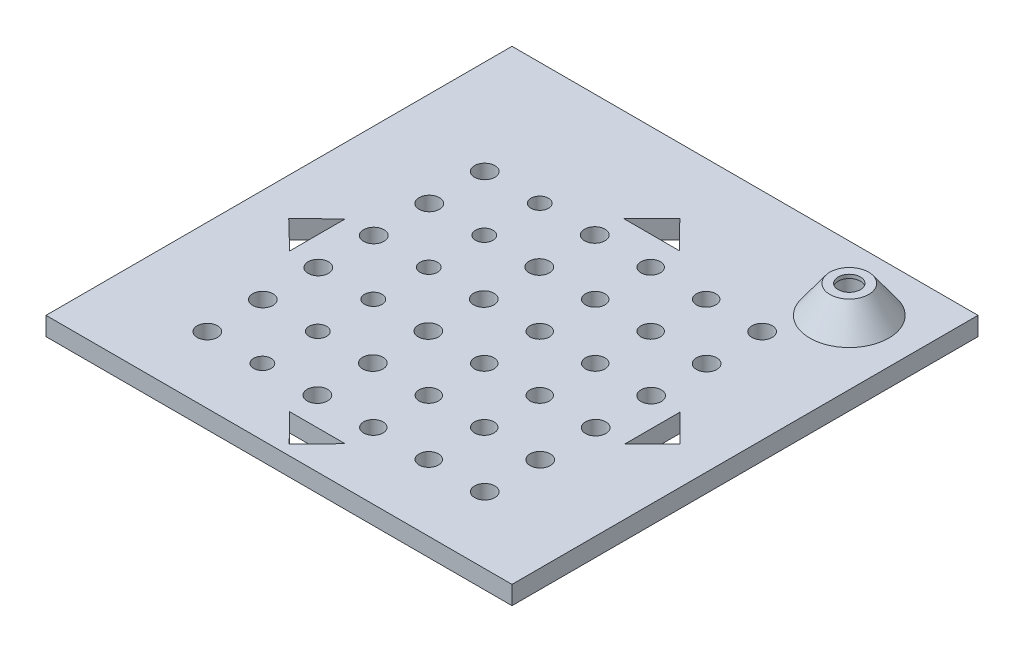
from build123d import *

# Parameters (mm, degrees)
SKETCH1_W           = 126
SKETCH1_H           = 126
BOSS_EXTRUDE1_DEPTH = 5
SKETCH3_R           = 12.5
BOSS_EXTRUDE2_DEPTH = 7.5
SKETCH4_R           = 3.45
CUT_EXTRUDE1_DEPTH  = 11.5
SKETCH6_R           = 3
CUT_EXTRUDE2_DEPTH  = 179.628805068
CHAMFER1_SIZE       = 10
CHAMFER1_SIZE_2     = 7.26542528
SKETCH7_R           = 2.75
SKETCH7_R_2         = 2.625
SKETCH7_R_3         = 2.375
CUT_EXTRUDE3_DEPTH  = 179.348675353
CUT_EXTRUDE4_DEPTH  = 179.348675353


with BuildPart() as part:
    # Sketch1 → Boss-Extrude1 (new body)
    with BuildSketch(Plane(origin=(0, 0, 0), x_dir=(1, 0, 0), z_dir=(0, 1, 0))):
        with Locations((63, 63)):
            Rectangle(SKETCH1_W, SKETCH1_H)
    extrude(amount=BOSS_EXTRUDE1_DEPTH)

    # Sketch3 → Boss-Extrude2 (add)
    with BuildSketch(Plane(origin=(0, 5, 0), x_dir=(1, 0, 0), z_dir=(0, 1, 0))):
        with Locations(Location((108.6, 108.6, 0), (0, 0, 90))):
            Circle(SKETCH3_R)
    extrude(amount=BOSS_EXTRUDE2_DEPTH)

    # Sketch4 → Cut-Extrude1 (cut)
    with BuildSketch(Plane.XZ):
        with Locations(Location((108.6, -108.6, 0), (0, 0, 270))):
            Circle(SKETCH4_R)
    extrude(amount=-CUT_EXTRUDE1_DEPTH, mode=Mode.SUBTRACT)

    # Sketch6 → Cut-Extrude2 (cut, through all)
    with BuildSketch(Plane(origin=(0, 12.5, 0), x_dir=(1, 0, 0), z_dir=(0, 1, 0))):
        with Locations(Location((108.6, 108.6, 0), (0, 0, 270))):
            Circle(SKETCH6_R)
    extrude(amount=-CUT_EXTRUDE2_DEPTH, mode=Mode.SUBTRACT)

    # Chamfer1
    # the kernel refuses this chamfer: 10, 7.26542528 mm, written as the material it takes off along each edge
    with BuildSketch(Plane(origin=(108.6, 12.5, -108.6), x_dir=(0, 0, -1), z_dir=(1, 0, 0))) as chamfer1_piece_1_section:
        Polygon((12.5, -CHAMFER1_SIZE), (12.5 - CHAMFER1_SIZE_2, 0), (12.5, 0), align=None)
    chamfer1_piece_1 = revolve(axis=Axis((108.6, 12.5, -108.6), (0, 1, 0)), mode=Mode.PRIVATE)
    chamfer1_piece_1 = split(chamfer1_piece_1, bisect_by=Plane(origin=(108.6, 5, -100.650989912), z_dir=(0, 1, 0)), keep=Keep.TOP, mode=Mode.PRIVATE)
    add(chamfer1_piece_1, mode=Mode.SUBTRACT)

    # Sketch7 → Cut-Extrude3 (cut, through all)
    with BuildSketch(Plane(origin=(0, 5, 0), x_dir=(1, 0, 0), z_dir=(0, 1, 0))):
        with Locations(Location((55.375, 63, 0), (0, 0, 270))):
            Circle(SKETCH7_R)
        with Locations(Location((70.5, 63, 0), (0, 0, 270))):
            Circle(SKETCH7_R_2)
        with Locations(Location((40.5, 63, 0), (0, 0, 270))):
            Circle(SKETCH7_R_3)
        with Locations(Location((85.5, 63, 0), (0, 0, 270))):
            Circle(SKETCH7_R_2)
        with Locations(Location((25.625, 63, 0), (0, 0, 270))):
            Circle(SKETCH7_R)
        with Locations(Location((100.625, 63, 0), (0, 0, 270))):
            Circle(SKETCH7_R)
        with Locations(Location((25.625, 48, 0), (0, 0, 270))):
            Circle(SKETCH7_R)
        with Locations(Location((40.5, 48, 0), (0, 0, 270))):
            Circle(SKETCH7_R_3)
        with Locations(Location((55.375, 48, 0), (0, 0, 270))):
            Circle(SKETCH7_R)
        with Locations(Location((70.5, 48, 0), (0, 0, 270))):
            Circle(SKETCH7_R_2)
        with Locations(Location((85.5, 48, 0), (0, 0, 270))):
            Circle(SKETCH7_R_2)
        with Locations(Location((100.625, 48, 0), (0, 0, 270))):
            Circle(SKETCH7_R)
        with Locations(Location((25.625, 33, 0), (0, 0, 270))):
            Circle(SKETCH7_R)
        with Locations(Location((40.5, 33, 0), (0, 0, 270))):
            Circle(SKETCH7_R_3)
        with Locations(Location((55.375, 33, 0), (0, 0, 270))):
            Circle(SKETCH7_R)
        with Locations(Location((70.5, 33, 0), (0, 0, 270))):
            Circle(SKETCH7_R_2)
        with Locations(Location((85.5, 33, 0), (0, 0, 270))):
            Circle(SKETCH7_R_2)
        with Locations(Location((100.625, 33, 0), (0, 0, 270))):
            Circle(SKETCH7_R)
        with Locations(Location((25.625, 18, 0), (0, 0, 270))):
            Circle(SKETCH7_R)
        with Locations(Location((40.5, 18, 0), (0, 0, 270))):
            Circle(SKETCH7_R_3)
        with Locations(Location((55.375, 18, 0), (0, 0, 270))):
            Circle(SKETCH7_R)
        with Locations(Location((70.5, 18, 0), (0, 0, 270))):
            Circle(SKETCH7_R_2)
        with Locations(Location((85.5, 18, 0), (0, 0, 270))):
            Circle(SKETCH7_R_2)
        with Locations(Location((100.625, 18, 0), (0, 0, 270))):
            Circle(SKETCH7_R)
        with Locations(Location((25.625, 78, 0), (0, 0, 270))):
            Circle(SKETCH7_R)
        with Locations(Location((40.5, 78, 0), (0, 0, 270))):
            Circle(SKETCH7_R_3)
        with Locations(Location((55.375, 78, 0), (0, 0, 270))):
            Circle(SKETCH7_R)
        with Locations(Location((70.5, 78, 0), (0, 0, 270))):
            Circle(SKETCH7_R_2)
        with Locations(Location((85.5, 78, 0), (0, 0, 270))):
            Circle(SKETCH7_R_2)
        with Locations(Location((100.625, 78, 0), (0, 0, 270))):
            Circle(SKETCH7_R)
        with Locations(Location((25.625, 93, 0), (0, 0, 270))):
            Circle(SKETCH7_R)
        with Locations(Location((40.5, 93, 0), (0, 0, 270))):
            Circle(SKETCH7_R_3)
        with Locations(Location((55.375, 93, 0), (0, 0, 270))):
            Circle(SKETCH7_R)
        with Locations(Location((70.5, 93, 0), (0, 0, 270))):
            Circle(SKETCH7_R_2)
        with Locations(Location((85.5, 93, 0), (0, 0, 270))):
            Circle(SKETCH7_R_2)
        with Locations(Location((100.625, 93, 0), (0, 0, 270))):
            Circle(SKETCH7_R)
    extrude(amount=-CUT_EXTRUDE3_DEPTH, mode=Mode.SUBTRACT)

    # Sketch8 → Cut-Extrude4 (cut, through all)
    with BuildSketch(Plane(origin=(0, 5, 0), x_dir=(1, 0, 0), z_dir=(0, 1, 0))):
        Polygon((70.5, 100.747162737), (63, 108.375), (55.49988754, 100.747162737), align=None)
        Polygon((108.375, 63), (115.875, 55.5), (108.375, 48), align=None)
        Polygon((55.5, 10.375), (63, 2.75), (70.5, 10.375), align=None)
        Polygon((17.875, 63), (17.875, 48), (10.125, 55.5), align=None)
    extrude(amount=-CUT_EXTRUDE4_DEPTH, mode=Mode.SUBTRACT)


solid = part.part
